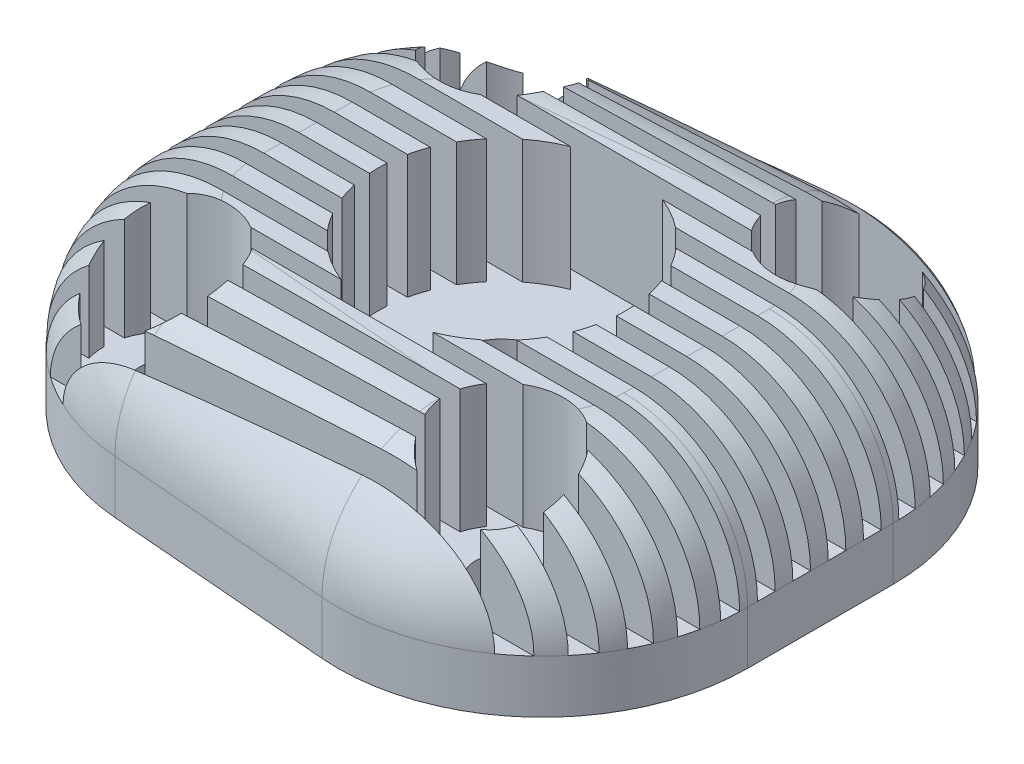
from build123d import *

# Parameters (mm, degrees)
BOSS_EXTRUDE1_DEPTH = 10
BOSS_EXTRUDE2_DEPTH = 0.5
SKETCH4_R           = 10.5
BOSS_EXTRUDE3_DEPTH = 3.5
FILLET2_R           = 7
SKETCH10_W          = 1
SKETCH10_H          = 8
CUT_EXTRUDE12_DEPTH = 41.496457645
CUT_EXTRUDE13_REACH = 29.702
SKETCH5_R           = 3
SKETCH7_R           = 7
CUT_EXTRUDE14_DEPTH = 7
SKETCH8_R           = 1.5
CUT_EXTRUDE15_DEPTH = 28.702109767
SKETCH14_R          = 3.5
CUT_EXTRUDE17_DEPTH = 7
SKETCH15_R          = 6.5
CUT_EXTRUDE18_DEPTH = 3.5
FILLET3_R           = 3.5


with BuildPart() as part:
    # Sketch1 → Boss-Extrude1 (new body)
    with BuildSketch(Plane(origin=(0, 0, 0), x_dir=(1, 0, 0), z_dir=(0, 1, 0))):
        with BuildLine():
            Line((5.221208107, 15.707982117), (-7.530335871, 14.431615523))
            ThreePointArc((-7.530335871, 14.431615523), (-14.971287665, 10.675040884), (-17.968084697, 2.896941876))
            Line((-17.968084697, 2.896941876), (-17.968084697, -3.014523864))
            ThreePointArc((-17.968084697, -3.014523864), (-14.899796733, -10.870904461), (-7.319180092, -14.568384477))
            Line((-7.319180092, -14.568384477), (5.432363886, -15.609587094))
            ThreePointArc((5.432363886, -15.609587094), (14.232152586, -12.579751225), (17.968084697, -4.055726481))
            Line((17.968084697, -4.055726481), (17.968084697, 4.173308469))
            ThreePointArc((17.968084697, 4.173308469), (14.153870997, 12.768824145), (5.221208107, 15.707982117))
        make_face()
    extrude(amount=BOSS_EXTRUDE1_DEPTH)

    # Sketch3 → Boss-Extrude2 (add)
    with BuildSketch(Plane.XZ):
        with BuildLine():
            Line((-15.968084697, 3.014523864), (-15.968084697, -2.896941876))
            ThreePointArc((-15.968084697, -2.896941876), (-13.488319444, -9.33310003), (-7.331141127, -12.441559882))
            Line((-7.331141127, -12.441559882), (5.420402852, -13.717926476))
            ThreePointArc((5.420402852, -13.717926476), (12.811930143, -11.285855924), (15.968084697, -4.173308469))
            Line((15.968084697, -4.173308469), (15.968084697, 4.055726481))
            ThreePointArc((15.968084697, 4.055726481), (12.876705956, 11.109117201), (5.595128319, 13.616221162))
            Line((5.595128319, 13.616221162), (-7.156415659, 12.575018545))
            ThreePointArc((-7.156415659, 12.575018545), (-13.429162708, 9.515457831), (-15.968084697, 3.014523864))
        make_face()
    extrude(amount=BOSS_EXTRUDE2_DEPTH)

    # Sketch4 → Boss-Extrude3 (add)
    with BuildSketch(Plane.XZ.offset(0.5)):
        with Locations(Location((0, 0, 0), (0, 0, 270))):
            Circle(SKETCH4_R)
    extrude(amount=BOSS_EXTRUDE3_DEPTH)

    # Fillet2
    fillet2_edges = [part.edges().sort_by_distance(p)[0] for p in [
        (-14.971287665, 10, -10.675040884),
        (-17.968084697, 10, 0.058790994),
        (-14.899796733, 10, 10.870904461),
        (-0.943408103, 10, 15.088985786),
        (14.232152586, 10, 12.579751225),
        (17.968084697, 10, -0.058790994),
        (14.153870997, 10, -12.768824145),
        (-1.154563882, 10, -15.06979882),
    ]]
    fillet(fillet2_edges, radius=FILLET2_R)

    # Sketch10 → Cut-Extrude12 (cut, through all)
    with BuildSketch(Plane(origin=(17.968084697, 0, 0), x_dir=(0, 0, -1), z_dir=(1, 0, 0))):
        with Locations((-13, 7)):
            Rectangle(SKETCH10_W, SKETCH10_H)
        with Locations((-11, 7)):
            Rectangle(SKETCH10_W, SKETCH10_H)
        with Locations((-9, 7)):
            Rectangle(SKETCH10_W, SKETCH10_H)
        with Locations((-7, 7)):
            Rectangle(SKETCH10_W, SKETCH10_H)
        with Locations((-5, 7)):
            Rectangle(SKETCH10_W, SKETCH10_H)
        with Locations((-3, 7)):
            Rectangle(SKETCH10_W, SKETCH10_H)
        with Locations((-1, 7)):
            Rectangle(SKETCH10_W, SKETCH10_H)
        with Locations((1, 7)):
            Rectangle(SKETCH10_W, SKETCH10_H)
        with Locations((3, 7)):
            Rectangle(SKETCH10_W, SKETCH10_H)
        with Locations((5, 7)):
            Rectangle(SKETCH10_W, SKETCH10_H)
        with Locations((7, 7)):
            Rectangle(SKETCH10_W, SKETCH10_H)
        with Locations((9, 7)):
            Rectangle(SKETCH10_W, SKETCH10_H)
        with Locations((11, 7)):
            Rectangle(SKETCH10_W, SKETCH10_H)
        with Locations((13, 7)):
            Rectangle(SKETCH10_W, SKETCH10_H)
    extrude(amount=-CUT_EXTRUDE12_DEPTH, mode=Mode.SUBTRACT)

    # Sketch5 → Cut-Extrude13 (cut, up to next)
    with BuildSketch(Plane.XZ.offset(4), mode=Mode.PRIVATE) as cut_extrude13_sk1:
        with Locations(Location((0, 0, 0), (0, 0, 270))):
            Circle(SKETCH5_R)
    cut_extrude13_tool1 = extrude(cut_extrude13_sk1.sketch, amount=-CUT_EXTRUDE13_REACH, mode=Mode.PRIVATE) & part.part
    add(cut_extrude13_tool1.solids().sort_by_distance((0, -4, 0))[0], mode=Mode.SUBTRACT)

    # Sketch7 → Cut-Extrude14 (cut)
    with BuildSketch(Plane(origin=(0, 10, 0), x_dir=(1, 0, 0), z_dir=(0, 1, 0))):
        Circle(SKETCH7_R)
    extrude(amount=-CUT_EXTRUDE14_DEPTH, mode=Mode.SUBTRACT)

    # Sketch8 → Cut-Extrude15 (cut, through all)
    with BuildSketch(Plane(origin=(0, 10, 0), x_dir=(1, 0, 0), z_dir=(0, 1, 0))):
        with Locations(Location((-9.5, 9.5, 0), (0, 0, 318.189685104))):
            Circle(SKETCH8_R)
        with Locations(Location((9.5, 9.5, 0), (0, 0, 221.810314901))):
            Circle(SKETCH8_R)
        with Locations(Location((9.5, -9.5, 0), (0, 0, 221.810314896))):
            Circle(SKETCH8_R)
        with Locations(Location((-9.5, -9.5, 0), (0, 0, 318.189683418))):
            Circle(SKETCH8_R)
    extrude(amount=-CUT_EXTRUDE15_DEPTH, mode=Mode.SUBTRACT)

    # Sketch14 → Cut-Extrude17 (cut)
    with BuildSketch(Plane(origin=(0, 10, 0), x_dir=(1, 0, 0), z_dir=(0, 1, 0))):
        with Locations((-9.5, 9.5)):
            Circle(SKETCH14_R)
        with Locations((9.5, 9.5)):
            Circle(SKETCH14_R)
        with Locations((9.5, -9.5)):
            Circle(SKETCH14_R)
        with Locations((-9.5, -9.5)):
            Circle(SKETCH14_R)
    extrude(amount=-CUT_EXTRUDE17_DEPTH, mode=Mode.SUBTRACT)

    # Sketch15 → Cut-Extrude18 (cut)
    with BuildSketch(Plane.XZ.offset(4)):
        with Locations(Location((0, 0, 0), (0, 0, 270))):
            Circle(SKETCH15_R)
    extrude(amount=-CUT_EXTRUDE18_DEPTH, mode=Mode.SUBTRACT)

    # Fillet3
    fillet3_edges = [part.edges().sort_by_distance(p)[0] for p in [
        (0, -0.5, 6.5),
    ]]
    fillet(fillet3_edges, radius=FILLET3_R - 0.0001)  # a hair under: the kernel refuses the full size


solid = part.part
